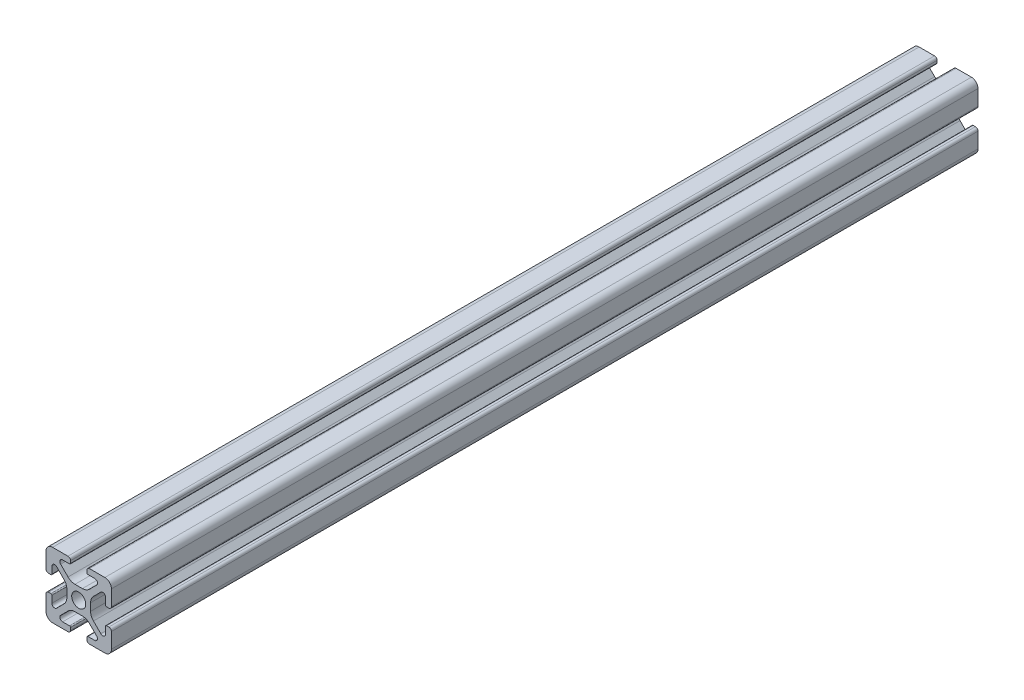
from build123d import *

# Parameters (mm, degrees)
SKETCH1_R           = 2.1463
BOSS_EXTRUDE1_DEPTH = 132.4102


with BuildPart() as part:
    # Sketch1 → Boss-Extrude1 (new, symmetric)
    with BuildSketch(Plane.XY):
        with BuildLine():
            Line((-9.9949, 7.9883), (-9.9949, 3.2893))
            ThreePointArc((-9.9949, 3.2893), (-9.76427588, 2.73252412), (-9.2075, 2.5019))
            Line((-9.2075, 2.5019), (-8.4963, 2.5019))
            ThreePointArc((-8.4963, 2.5019), (-8.280773853, 2.591173853), (-8.1915, 2.8067))
            Line((-8.1915, 2.8067), (-8.1915, 4.9149))
            ThreePointArc((-8.1915, 4.9149), (-7.674065253, 5.689295824), (-6.760603096, 5.507596904))
            Line((-6.760603096, 5.507596904), (-4.505765747, 3.252759555))
            ThreePointArc((-4.505765747, 3.252759555), (-3.856054457, 2.280397894), (-3.627906192, 1.133419111))
            Line((-3.627906192, 1.133419111), (-3.627906192, -1.133419111))
            ThreePointArc((-3.627906192, -1.133419111), (-3.856054457, -2.280397894), (-4.505765747, -3.252759555))
            Line((-4.505765747, -3.252759555), (-6.760603096, -5.507596904))
            ThreePointArc((-6.760603096, -5.507596904), (-7.674065253, -5.689295824), (-8.1915, -4.9149))
            Line((-8.1915, -4.9149), (-8.1915, -2.8067))
            ThreePointArc((-8.1915, -2.8067), (-8.280773853, -2.591173853), (-8.4963, -2.5019))
            Line((-8.4963, -2.5019), (-9.2075, -2.5019))
            ThreePointArc((-9.2075, -2.5019), (-9.76427588, -2.73252412), (-9.9949, -3.2893))
            Line((-9.9949, -3.2893), (-9.9949, -7.9883))
            ThreePointArc((-9.9949, -7.9883), (-9.407180467, -9.407180467), (-7.9883, -9.9949))
            Line((-7.9883, -9.9949), (-3.2893, -9.9949))
            ThreePointArc((-3.2893, -9.9949), (-2.73252412, -9.76427588), (-2.5019, -9.2075))
            Line((-2.5019, -9.2075), (-2.5019, -8.4963))
            ThreePointArc((-2.5019, -8.4963), (-2.591173853, -8.280773853), (-2.8067, -8.1915))
            Line((-2.8067, -8.1915), (-4.9149, -8.1915))
            ThreePointArc((-4.9149, -8.1915), (-5.689295824, -7.674065253), (-5.507596904, -6.760603096))
            Line((-5.507596904, -6.760603096), (-3.252759555, -4.505765747))
            ThreePointArc((-3.252759555, -4.505765747), (-2.280397894, -3.856054457), (-1.133419111, -3.627906192))
            Line((-1.133419111, -3.627906192), (1.133419111, -3.627906192))
            ThreePointArc((1.133419111, -3.627906192), (2.280397894, -3.856054457), (3.252759555, -4.505765747))
            Line((3.252759555, -4.505765747), (5.507596904, -6.760603096))
            ThreePointArc((5.507596904, -6.760603096), (5.689295824, -7.674065253), (4.9149, -8.1915))
            Line((4.9149, -8.1915), (2.8067, -8.1915))
            ThreePointArc((2.8067, -8.1915), (2.591173853, -8.280773853), (2.5019, -8.4963))
            Line((2.5019, -8.4963), (2.5019, -9.2075))
            ThreePointArc((2.5019, -9.2075), (2.73252412, -9.76427588), (3.2893, -9.9949))
            Line((3.2893, -9.9949), (7.9883, -9.9949))
            ThreePointArc((7.9883, -9.9949), (9.407180467, -9.407180467), (9.9949, -7.9883))
            Line((9.9949, -7.9883), (9.9949, -3.2893))
            ThreePointArc((9.9949, -3.2893), (9.76427588, -2.73252412), (9.2075, -2.5019))
            Line((9.2075, -2.5019), (8.4963, -2.5019))
            ThreePointArc((8.4963, -2.5019), (8.280773853, -2.591173853), (8.1915, -2.8067))
            Line((8.1915, -2.8067), (8.1915, -4.9149))
            ThreePointArc((8.1915, -4.9149), (7.674065253, -5.689295824), (6.760603096, -5.507596904))
            Line((6.760603096, -5.507596904), (4.505765747, -3.252759555))
            ThreePointArc((4.505765747, -3.252759555), (3.856054457, -2.280397894), (3.627906192, -1.133419111))
            Line((3.627906192, -1.133419111), (3.627906192, 1.133419111))
            ThreePointArc((3.627906192, 1.133419111), (3.856054457, 2.280397894), (4.505765747, 3.252759555))
            Line((4.505765747, 3.252759555), (6.760603096, 5.507596904))
            ThreePointArc((6.760603096, 5.507596904), (7.674065253, 5.689295824), (8.1915, 4.9149))
            Line((8.1915, 4.9149), (8.1915, 2.8067))
            ThreePointArc((8.1915, 2.8067), (8.280773853, 2.591173853), (8.4963, 2.5019))
            Line((8.4963, 2.5019), (9.2075, 2.5019))
            ThreePointArc((9.2075, 2.5019), (9.76427588, 2.73252412), (9.9949, 3.2893))
            Line((9.9949, 3.2893), (9.9949, 7.9883))
            ThreePointArc((9.9949, 7.9883), (9.407180467, 9.407180467), (7.9883, 9.9949))
            Line((7.9883, 9.9949), (3.2893, 9.9949))
            ThreePointArc((3.2893, 9.9949), (2.73252412, 9.76427588), (2.5019, 9.2075))
            Line((2.5019, 9.2075), (2.5019, 8.4963))
            ThreePointArc((2.5019, 8.4963), (2.591173853, 8.280773853), (2.8067, 8.1915))
            Line((2.8067, 8.1915), (4.9149, 8.1915))
            ThreePointArc((4.9149, 8.1915), (5.689295824, 7.674065253), (5.507596904, 6.760603096))
            Line((5.507596904, 6.760603096), (3.252759555, 4.505765747))
            ThreePointArc((3.252759555, 4.505765747), (2.280397894, 3.856054457), (1.133419111, 3.627906192))
            Line((1.133419111, 3.627906192), (-1.133419111, 3.627906192))
            ThreePointArc((-1.133419111, 3.627906192), (-2.280397894, 3.856054457), (-3.252759555, 4.505765747))
            Line((-3.252759555, 4.505765747), (-5.507596904, 6.760603096))
            ThreePointArc((-5.507596904, 6.760603096), (-5.689295824, 7.674065253), (-4.9149, 8.1915))
            Line((-4.9149, 8.1915), (-2.8067, 8.1915))
            ThreePointArc((-2.8067, 8.1915), (-2.591173853, 8.280773853), (-2.5019, 8.4963))
            Line((-2.5019, 8.4963), (-2.5019, 9.2075))
            ThreePointArc((-2.5019, 9.2075), (-2.73252412, 9.76427588), (-3.2893, 9.9949))
            Line((-3.2893, 9.9949), (-7.9883, 9.9949))
            ThreePointArc((-7.9883, 9.9949), (-9.407180467, 9.407180467), (-9.9949, 7.9883))
        make_face()
        Circle(SKETCH1_R, mode=Mode.SUBTRACT)
    extrude(amount=BOSS_EXTRUDE1_DEPTH, both=True)


solid = part.part
